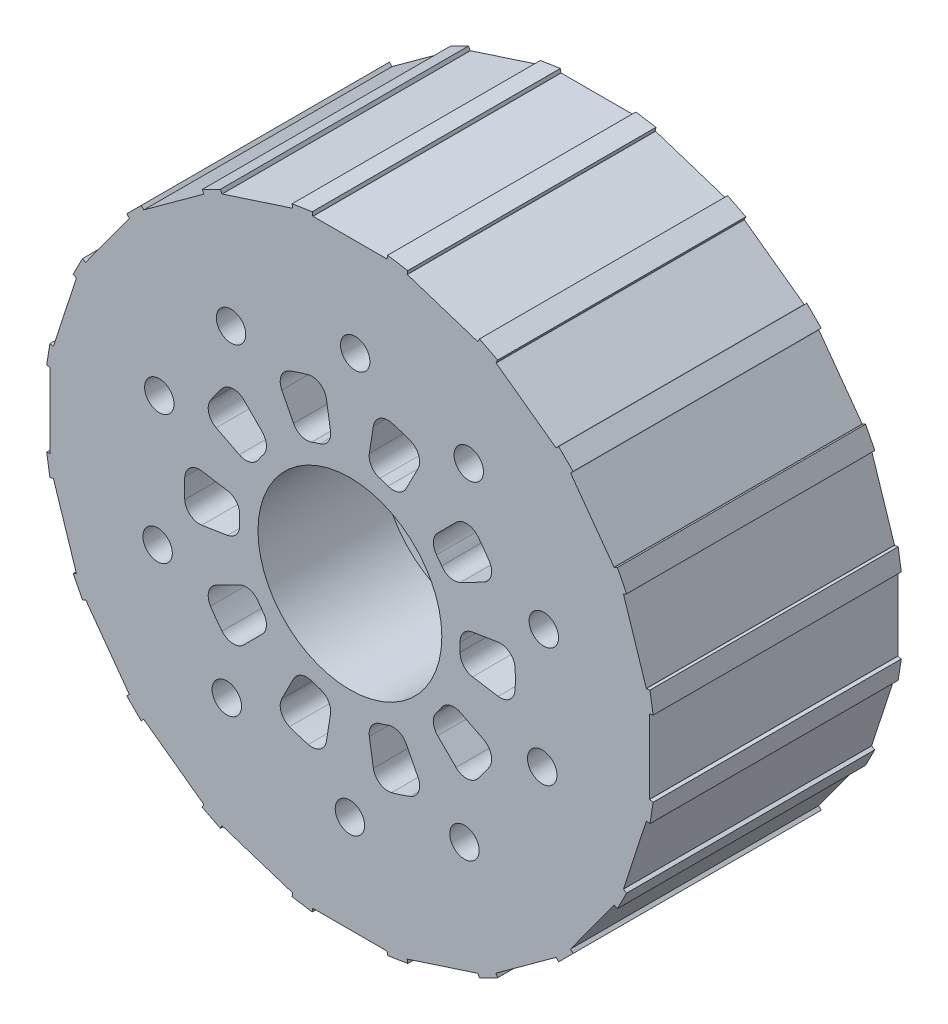
from build123d import *

# Parameters (mm, degrees)
BOSS_EXTRUDE1_DEPTH = 67.5
SKETCH2_R           = 68
CUT_EXTRUDE1_DEPTH  = 33.75
SKETCH3_R           = 4
CUT_EXTRUDE2_DEPTH  = 33.75
CUT_EXTRUDE3_DEPTH  = 33.75
SKETCH5_R           = 4
CUT_EXTRUDE4_DEPTH  = 122.418033578


with BuildPart() as part:
    # Sketch1 → Boss-Extrude1 (new body)
    with BuildSketch(Plane.XY):
        Polygon((10, 81.5), (0, 81.5), (-10, 81.5), (-10.098768834, 81.484356553), (-10.255203299, 82.472044894), (-15.73198551, 81.604607809), (-15.575551045, 80.616919468), (-15.674319879, 80.601276022), (-34.695450205, 74.420936134), (-34.784550857, 74.375537084), (-35.238541357, 75.266543609), (-40.179217965, 72.749143139), (-39.725227466, 71.858136614), (-39.814328118, 71.812737564), (-55.994668006, 60.057032519), (-56.065378684, 59.986321841), (-56.772485465, 60.693428622), (-60.693428622, 56.772485465), (-59.986321841, 56.065378684), (-60.057032519, 55.994668006), (-71.812737564, 39.814328118), (-71.858136614, 39.725227466), (-72.749143139, 40.179217965), (-75.266543609, 35.238541357), (-74.375537084, 34.784550857), (-74.420936134, 34.695450205), (-80.601276022, 15.674319879), (-80.616919468, 15.575551045), (-81.604607809, 15.73198551), (-82.472044894, 10.255203299), (-81.484356553, 10.098768834), (-81.5, 10), (-81.5, -10), (-81.484356553, -10.098768834), (-82.472044894, -10.255203299), (-81.604607809, -15.73198551), (-80.616919468, -15.575551045), (-80.601276022, -15.674319879), (-74.420936134, -34.695450205), (-74.375537084, -34.784550857), (-75.266543609, -35.238541357), (-72.749143139, -40.179217965), (-71.858136614, -39.725227466), (-71.812737564, -39.814328118), (-60.057032519, -55.994668006), (-59.986321841, -56.065378684), (-60.693428622, -56.772485465), (-56.772485465, -60.693428622), (-56.065378684, -59.986321841), (-55.994668006, -60.057032519), (-39.814328118, -71.812737564), (-39.725227466, -71.858136614), (-40.179217965, -72.749143139), (-35.238541357, -75.266543609), (-34.784550857, -74.375537084), (-34.695450205, -74.420936134), (-15.674319879, -80.601276022), (-15.575551045, -80.616919468), (-15.73198551, -81.604607809), (-10.255203299, -82.472044894), (-10.098768834, -81.484356553), (-10, -81.5), (10, -81.5), (10.098768834, -81.484356553), (10.255203299, -82.472044894), (15.73198551, -81.604607809), (15.575551045, -80.616919468), (15.674319879, -80.601276022), (34.695450205, -74.420936134), (34.784550857, -74.375537084), (35.238541357, -75.266543609), (40.179217965, -72.749143139), (39.725227466, -71.858136614), (39.814328118, -71.812737564), (55.994668006, -60.057032519), (56.065378684, -59.986321841), (56.772485465, -60.693428622), (60.693428622, -56.772485465), (59.986321841, -56.065378684), (60.057032519, -55.994668006), (71.812737564, -39.814328118), (71.858136614, -39.725227466), (72.749143139, -40.179217965), (75.266543609, -35.238541357), (74.375537084, -34.784550857), (74.420936134, -34.695450205), (80.601276022, -15.674319879), (80.616919468, -15.575551045), (81.604607809, -15.73198551), (82.472044894, -10.255203299), (81.484356554, -10.098768834), (81.5, -10), (81.5, 10), (81.484356553, 10.098768834), (82.472044894, 10.255203299), (81.604607809, 15.73198551), (80.616919468, 15.575551045), (80.601276022, 15.674319879), (74.420936134, 34.695450205), (74.375537084, 34.784550857), (75.266543609, 35.238541357), (72.749143139, 40.179217965), (71.858136614, 39.725227466), (71.812737564, 39.814328118), (60.057032519, 55.994668006), (59.986321841, 56.065378684), (60.693428622, 56.772485465), (56.772485465, 60.693428622), (56.065378684, 59.986321841), (55.994668006, 60.057032519), (39.814328118, 71.812737564), (39.725227466, 71.858136614), (40.179217965, 72.749143139), (35.238541357, 75.266543609), (34.784550857, 74.375537084), (34.695450205, 74.420936134), (15.674319879, 80.601276022), (15.575551045, 80.616919468), (15.73198551, 81.604607809), (10.255203299, 82.472044894), (10.098768834, 81.484356553), align=None)
        with BuildLine():
            ThreePointArc((25, 0), (-17.67766953, -17.67766953), (0, 25))
            ThreePointArc((0, 25), (17.67766953, 17.67766953), (25, 0))
        make_face(mode=Mode.SUBTRACT)
    extrude(amount=BOSS_EXTRUDE1_DEPTH)

    # Sketch2 → Cut-Extrude1 (cut)
    with BuildSketch(Plane(origin=(0, 0, 0), x_dir=(-1, 0, 0), z_dir=(0, 0, -1))):
        Circle(SKETCH2_R)
    extrude(amount=-CUT_EXTRUDE1_DEPTH, mode=Mode.SUBTRACT)

    # Sketch3 → Cut-Extrude2 (cut)
    with BuildSketch(Plane(origin=(0, 0, 33.75), x_dir=(-1, 0, 0), z_dir=(0, 0, -1))):
        with Locations((32.328188876, 44.495934691)):
            Circle(SKETCH3_R)
        with Locations((52.308108396, -16.995934691)):
            Circle(SKETCH3_R)
        with Locations((0, -55)):
            Circle(SKETCH3_R)
        with Locations((-52.308108396, -16.995934691)):
            Circle(SKETCH3_R)
        with Locations((-32.328188876, 44.495934691)):
            Circle(SKETCH3_R)
    extrude(amount=-CUT_EXTRUDE2_DEPTH, mode=Mode.SUBTRACT)

    # Sketch4 → Cut-Extrude3 (cut)
    with BuildSketch(Plane(origin=(0, 0, 33.75), x_dir=(-1, 0, 0), z_dir=(0, 0, -1))):
        with BuildLine():
            Line((-5.281835449, 33.348196567), (-6.383216288, 40.302041509))
            ThreePointArc((-6.383216288, 40.302041509), (-8.14367989, 43.023336778), (-11.342161812, 43.547162542))
            ThreePointArc((-11.342161812, 43.547162542), (-13.905764747, 42.797543233), (-16.420378262, 41.897149995))
            ThreePointArc((-16.420378262, 41.897149995), (-18.700107434, 39.593345547), (-18.52481518, 36.356996886))
            Line((-18.52481518, 36.356996886), (-15.328483493, 30.083842737))
            ThreePointArc((-15.328483493, 30.083842737), (-13.222545057, 28.175025497), (-10.380403585, 28.146886531))
            ThreePointArc((-10.380403585, 28.146886531), (-9.270509831, 28.531695489), (-8.146401893, 28.872757683))
            ThreePointArc((-8.146401893, 28.872757683), (-5.86360081, 30.566091427), (-5.281835449, 33.348196567))
        make_face()
        with BuildLine():
            Line((15.328483493, 30.083842737), (18.52481518, 36.356996886))
            ThreePointArc((18.52481518, 36.356996886), (18.700107434, 39.593345547), (16.420378262, 41.897149995))
            ThreePointArc((16.420378262, 41.897149995), (13.905764747, 42.797543233), (11.342161812, 43.547162542))
            ThreePointArc((11.342161812, 43.547162542), (8.14367989, 43.023336778), (6.383216288, 40.302041509))
            Line((6.383216288, 40.302041509), (5.281835449, 33.348196567))
            ThreePointArc((5.281835449, 33.348196567), (5.86360081, 30.566091427), (8.146401893, 28.872757683))
            ThreePointArc((8.146401893, 28.872757683), (9.270509831, 28.531695489), (10.380403585, 28.146886531))
            ThreePointArc((10.380403585, 28.146886531), (13.222545057, 28.175025497), (15.328483493, 30.083842737))
        make_face()
        with BuildLine():
            Line((30.083842737, 15.328483493), (36.356996886, 18.52481518))
            ThreePointArc((36.356996886, 18.52481518), (38.401089313, 21.040042045), (37.910891949, 24.243850182))
            ThreePointArc((37.910891949, 24.243850182), (36.405764747, 26.450336353), (34.77238158, 28.563639111))
            ThreePointArc((34.77238158, 28.563639111), (31.87685829, 30.019875669), (28.853076093, 28.853076093))
            Line((28.853076093, 28.853076093), (23.874672773, 23.874672773))
            ThreePointArc((23.874672773, 23.874672773), (22.710050465, 21.281949334), (23.561558733, 18.570216748))
            ThreePointArc((23.561558733, 18.570216748), (24.270509831, 17.633557569), (24.94224771, 16.669861403))
            ThreePointArc((24.94224771, 16.669861403), (27.25812813, 15.022057462), (30.083842737, 15.328483493))
        make_face()
        with BuildLine():
            Line((33.348196567, -5.281835449), (40.302041509, -6.383216288))
            ThreePointArc((40.302041509, -6.383216288), (43.434160278, -5.549842393), (44.920733454, -2.669776382))
            ThreePointArc((44.920733454, -2.669776382), (45, 0), (44.920733454, 2.669776382))
            ThreePointArc((44.920733454, 2.669776382), (43.434160278, 5.549842393), (40.302041509, 6.383216288))
            Line((40.302041509, 6.383216288), (33.348196567, 5.281835449))
            ThreePointArc((33.348196567, 5.281835449), (30.882032728, 3.868825943), (29.977000965, 1.174484194))
            ThreePointArc((29.977000965, 1.174484194), (30, 0), (29.977000965, -1.174484194))
            ThreePointArc((29.977000965, -1.174484194), (30.882032728, -3.868825943), (33.348196567, -5.281835449))
        make_face()
        with BuildLine():
            Line((23.874672773, -23.874672773), (28.853076093, -28.853076093))
            ThreePointArc((28.853076093, -28.853076093), (31.87685829, -30.019875669), (34.77238158, -28.563639111))
            ThreePointArc((34.77238158, -28.563639111), (36.405764747, -26.450336353), (37.910891949, -24.243850182))
            ThreePointArc((37.910891949, -24.243850182), (38.401089313, -21.040042045), (36.356996886, -18.52481518))
            Line((36.356996886, -18.52481518), (30.083842737, -15.328483493))
            ThreePointArc((30.083842737, -15.328483493), (27.25812813, -15.022057462), (24.94224771, -16.669861403))
            ThreePointArc((24.94224771, -16.669861403), (24.270509831, -17.633557569), (23.561558733, -18.570216748))
            ThreePointArc((23.561558733, -18.570216748), (22.710050465, -21.281949334), (23.874672773, -23.874672773))
        make_face()
        with BuildLine():
            Line((5.281835449, -33.348196567), (6.383216288, -40.302041509))
            ThreePointArc((6.383216288, -40.302041509), (8.14367989, -43.023336778), (11.342161812, -43.547162542))
            ThreePointArc((11.342161812, -43.547162542), (13.905764747, -42.797543233), (16.420378262, -41.897149995))
            ThreePointArc((16.420378262, -41.897149995), (18.700107434, -39.593345547), (18.52481518, -36.356996886))
            Line((18.52481518, -36.356996886), (15.328483493, -30.083842737))
            ThreePointArc((15.328483493, -30.083842737), (13.222545057, -28.175025497), (10.380403585, -28.146886531))
            ThreePointArc((10.380403585, -28.146886531), (9.270509831, -28.531695489), (8.146401893, -28.872757683))
            ThreePointArc((8.146401893, -28.872757683), (5.86360081, -30.566091427), (5.281835449, -33.348196567))
        make_face()
        with BuildLine():
            Line((-15.328483493, -30.083842737), (-18.52481518, -36.356996886))
            ThreePointArc((-18.52481518, -36.356996886), (-18.700107434, -39.593345547), (-16.420378262, -41.897149995))
            ThreePointArc((-16.420378262, -41.897149995), (-13.905764747, -42.797543233), (-11.342161812, -43.547162542))
            ThreePointArc((-11.342161812, -43.547162542), (-8.14367989, -43.023336778), (-6.383216288, -40.302041509))
            Line((-6.383216288, -40.302041509), (-5.281835449, -33.348196567))
            ThreePointArc((-5.281835449, -33.348196567), (-5.86360081, -30.566091427), (-8.146401893, -28.872757683))
            ThreePointArc((-8.146401893, -28.872757683), (-9.270509831, -28.531695489), (-10.380403585, -28.146886531))
            ThreePointArc((-10.380403585, -28.146886531), (-13.222545057, -28.175025497), (-15.328483493, -30.083842737))
        make_face()
        with BuildLine():
            Line((-30.083842737, 15.328483493), (-36.356996886, 18.52481518))
            ThreePointArc((-36.356996886, 18.52481518), (-38.401089313, 21.040042045), (-37.910891949, 24.243850182))
            ThreePointArc((-37.910891949, 24.243850182), (-36.405764747, 26.450336353), (-34.77238158, 28.563639111))
            ThreePointArc((-34.77238158, 28.563639111), (-31.87685829, 30.019875669), (-28.853076093, 28.853076093))
            Line((-28.853076093, 28.853076093), (-23.874672773, 23.874672773))
            ThreePointArc((-23.874672773, 23.874672773), (-22.710050465, 21.281949334), (-23.561558733, 18.570216748))
            ThreePointArc((-23.561558733, 18.570216748), (-24.270509831, 17.633557569), (-24.94224771, 16.669861403))
            ThreePointArc((-24.94224771, 16.669861403), (-27.25812813, 15.022057462), (-30.083842737, 15.328483493))
        make_face()
        with BuildLine():
            Line((-30.083842737, -15.328483493), (-36.356996886, -18.52481518))
            ThreePointArc((-36.356996886, -18.52481518), (-38.401089313, -21.040042045), (-37.910891949, -24.243850182))
            ThreePointArc((-37.910891949, -24.243850182), (-36.405764747, -26.450336353), (-34.77238158, -28.563639111))
            ThreePointArc((-34.77238158, -28.563639111), (-31.87685829, -30.019875669), (-28.853076093, -28.853076093))
            Line((-28.853076093, -28.853076093), (-23.874672773, -23.874672773))
            ThreePointArc((-23.874672773, -23.874672773), (-22.710050465, -21.281949334), (-23.561558733, -18.570216748))
            ThreePointArc((-23.561558733, -18.570216748), (-24.270509831, -17.633557569), (-24.94224771, -16.669861403))
            ThreePointArc((-24.94224771, -16.669861403), (-27.25812813, -15.022057462), (-30.083842737, -15.328483493))
        make_face()
        with BuildLine():
            Line((-33.348196567, 5.281835449), (-40.302041509, 6.383216288))
            ThreePointArc((-40.302041509, 6.383216288), (-43.434160278, 5.549842393), (-44.920733454, 2.669776382))
            ThreePointArc((-44.920733454, 2.669776382), (-45, 0), (-44.920733454, -2.669776382))
            ThreePointArc((-44.920733454, -2.669776382), (-43.434160278, -5.549842393), (-40.302041509, -6.383216288))
            Line((-40.302041509, -6.383216288), (-33.348196567, -5.281835449))
            ThreePointArc((-33.348196567, -5.281835449), (-30.882032728, -3.868825943), (-29.977000965, -1.174484194))
            ThreePointArc((-29.977000965, -1.174484194), (-30, 0), (-29.977000965, 1.174484194))
            ThreePointArc((-29.977000965, 1.174484194), (-30.882032728, 3.868825943), (-33.348196567, 5.281835449))
        make_face()
    extrude(amount=-CUT_EXTRUDE3_DEPTH, mode=Mode.SUBTRACT)

    # Sketch5 → Cut-Extrude4 (cut, through all)
    with BuildSketch(Plane(origin=(0, 0, 33.75), x_dir=(-1, 0, 0), z_dir=(0, 0, -1))):
        with Locations((-1.439732157, 54.981152874)):
            Circle(SKETCH5_R)
        with Locations((51.84528201, 18.359377258)):
            Circle(SKETCH5_R)
        with Locations((33.481878595, -43.634433716)):
            Circle(SKETCH5_R)
        with Locations((-31.152343031, -45.326940374)):
            Circle(SKETCH5_R)
        with Locations((-52.735085418, 15.620843959)):
            Circle(SKETCH5_R)
    extrude(amount=-CUT_EXTRUDE4_DEPTH, mode=Mode.SUBTRACT)


solid = part.part
